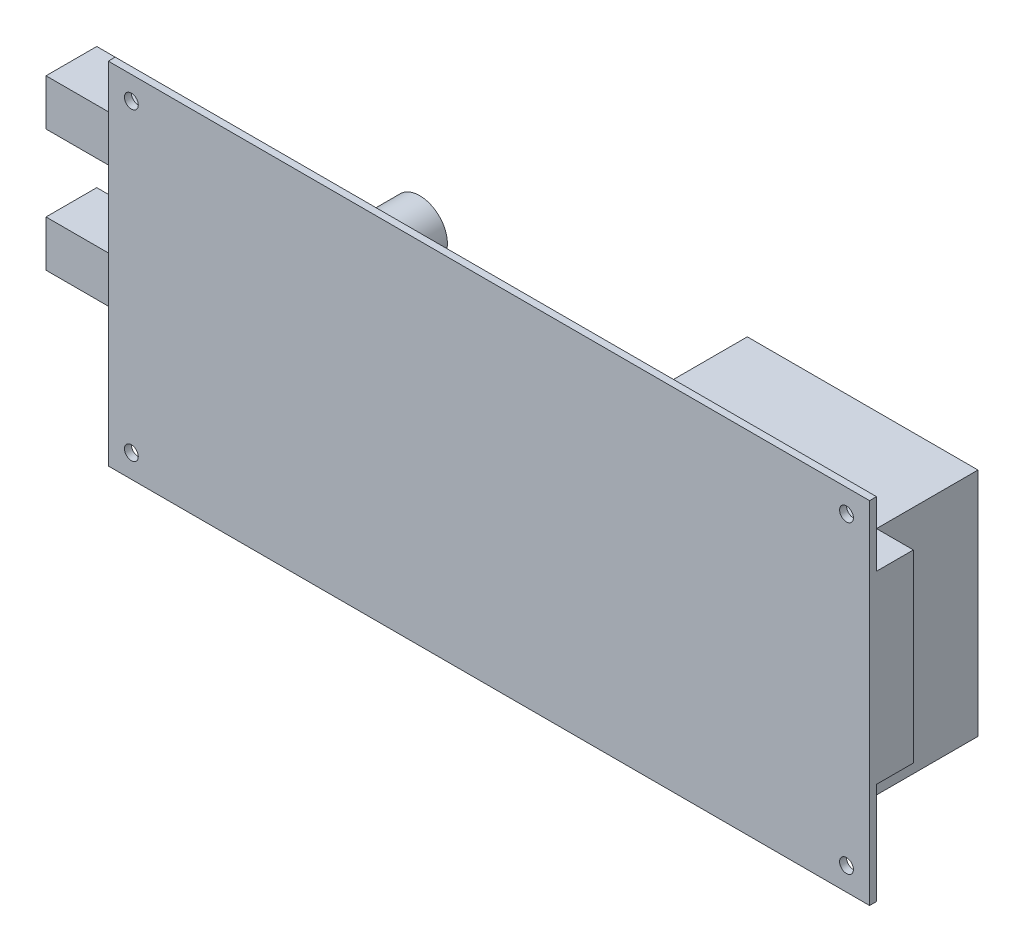
from build123d import *

# Parameters (mm, degrees)
SKETCH1_W           = 165
SKETCH1_H           = 76
BOSS_EXTRUDE1_DEPTH = 1.5
CUT_EXTRUDE1_REACH  = 140.731
SKETCH2_R           = 1.5
SKETCH3_W           = 12
SKETCH3_H           = 40
BOSS_EXTRUDE2_DEPTH = 8
SKETCH4_W           = 50
SKETCH4_H           = 50
BOSS_EXTRUDE3_DEPTH = 32
SKETCH5_W           = 30
SKETCH5_H           = 10
BOSS_EXTRUDE4_DEPTH = 11
SKETCH6_R           = 6
BOSS_EXTRUDE5_DEPTH = 25


with BuildPart() as part:
    # Sketch1 → Boss-Extrude1 (new body)
    with BuildSketch(Plane.XY):
        with Locations((47.261306533, -11.052763819)):
            Rectangle(SKETCH1_W, SKETCH1_H)
    extrude(amount=BOSS_EXTRUDE1_DEPTH)

    # Sketch2 → Cut-Extrude1 (cut, up to next)
    with BuildSketch(Plane.XY.offset(1.5), mode=Mode.PRIVATE) as cut_extrude1_sk1:
        with Locations((124.761306533, 21.947236181)):
            Circle(SKETCH2_R)
    cut_extrude1_tool1 = extrude(cut_extrude1_sk1.sketch, amount=-CUT_EXTRUDE1_REACH, mode=Mode.PRIVATE) & part.part
    # Sketch2 → Cut-Extrude1 (cut, up to next)
    with BuildSketch(Plane.XY.offset(1.5), mode=Mode.PRIVATE) as cut_extrude1_sk2:
        with Locations((124.761306533, -44.052763819)):
            Circle(SKETCH2_R)
    cut_extrude1_tool2 = extrude(cut_extrude1_sk2.sketch, amount=-CUT_EXTRUDE1_REACH, mode=Mode.PRIVATE) & part.part
    # Sketch2 → Cut-Extrude1 (cut, up to next)
    with BuildSketch(Plane.XY.offset(1.5), mode=Mode.PRIVATE) as cut_extrude1_sk3:
        with Locations((-30.238693467, -44.052763819)):
            Circle(SKETCH2_R)
    cut_extrude1_tool3 = extrude(cut_extrude1_sk3.sketch, amount=-CUT_EXTRUDE1_REACH, mode=Mode.PRIVATE) & part.part
    # Sketch2 → Cut-Extrude1 (cut, up to next)
    with BuildSketch(Plane.XY.offset(1.5), mode=Mode.PRIVATE) as cut_extrude1_sk4:
        with Locations((-30.238693467, 21.947236181)):
            Circle(SKETCH2_R)
    cut_extrude1_tool4 = extrude(cut_extrude1_sk4.sketch, amount=-CUT_EXTRUDE1_REACH, mode=Mode.PRIVATE) & part.part
    add(cut_extrude1_tool1.solids().sort_by_distance((124.761307, 21.947236, 1.5))[0], mode=Mode.SUBTRACT)
    add(cut_extrude1_tool2.solids().sort_by_distance((124.761307, -44.052764, 1.5))[0], mode=Mode.SUBTRACT)
    add(cut_extrude1_tool3.solids().sort_by_distance((-30.238693, -44.052764, 1.5))[0], mode=Mode.SUBTRACT)
    add(cut_extrude1_tool4.solids().sort_by_distance((-30.238693, 21.947236, 1.5))[0], mode=Mode.SUBTRACT)

    # Sketch3 → Boss-Extrude2 (add)
    with BuildSketch(Plane(origin=(0, 0, 0), x_dir=(-1, 0, 0), z_dir=(0, 0, -1))):
        with Locations((-123.761306533, -7.052763819)):
            Rectangle(SKETCH3_W, SKETCH3_H)
    extrude(amount=BOSS_EXTRUDE2_DEPTH)

    # Sketch4 → Boss-Extrude3 (add)
    with BuildSketch(Plane(origin=(0, 0, 0), x_dir=(-1, 0, 0), z_dir=(0, 0, -1))):
        with Locations((-94.761306533, -14.052763819)):
            Rectangle(SKETCH4_W, SKETCH4_H)
    extrude(amount=BOSS_EXTRUDE3_DEPTH)

    # Sketch5 → Boss-Extrude4 (add)
    with BuildSketch(Plane(origin=(0, 0, 0), x_dir=(-1, 0, 0), z_dir=(0, 0, -1))):
        with Locations((35.238693467, 10.947236181)):
            Rectangle(SKETCH5_W, SKETCH5_H)
        with Locations((35.238693467, -15.552763819)):
            Rectangle(SKETCH5_W, SKETCH5_H)
    extrude(amount=BOSS_EXTRUDE4_DEPTH)

    # Sketch6 → Boss-Extrude5 (add)
    with BuildSketch(Plane(origin=(0, 0, 0), x_dir=(-1, 0, 0), z_dir=(0, 0, -1))):
        with Locations((-5.761306533, 2.947236181)):
            Circle(SKETCH6_R)
    extrude(amount=BOSS_EXTRUDE5_DEPTH)


solid = part.part
